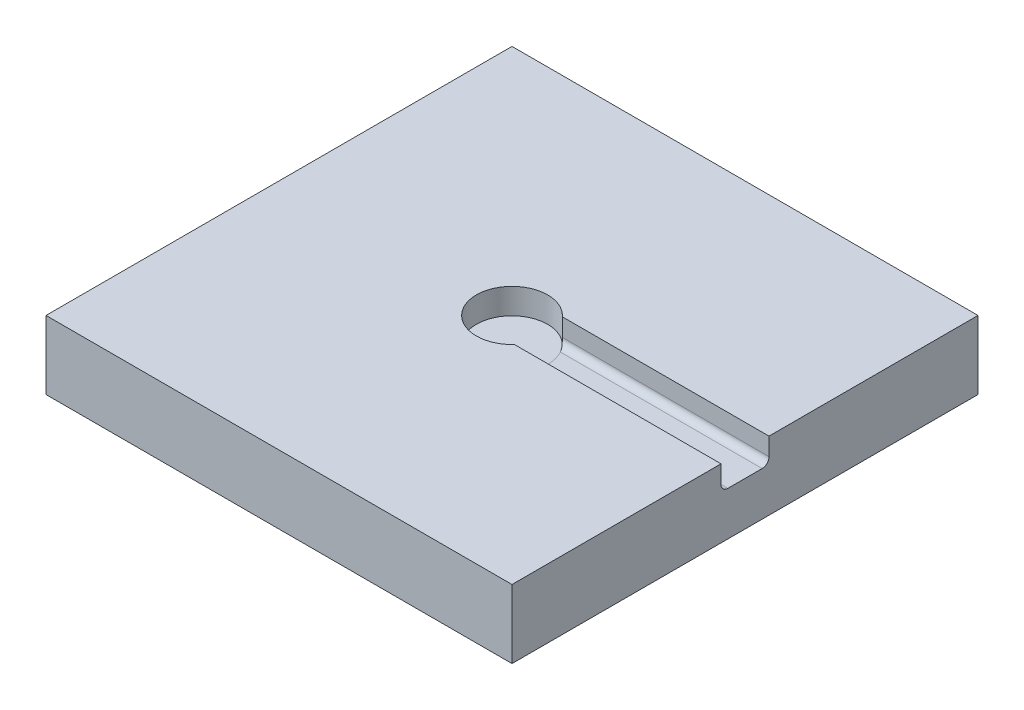
from build123d import *

# Parameters (mm, degrees)
SKETCH1_W           = 340
SKETCH1_H           = 340
BOSS_EXTRUDE1_DEPTH = 50
SKETCH2_R           = 26
CUT_EXTRUDE1_DEPTH  = 18.6
SKETCH3_W           = 35
SKETCH3_H           = 18
CUT_EXTRUDE2_DEPTH  = 170
FILLET1_R           = 5


with BuildPart() as part:
    # Sketch1 → Boss-Extrude1 (new body)
    with BuildSketch(Plane(origin=(0, 0, 0), x_dir=(1, 0, 0), z_dir=(0, 1, 0))):
        Rectangle(SKETCH1_W, SKETCH1_H)
    extrude(amount=BOSS_EXTRUDE1_DEPTH)

    # Sketch2 → Cut-Extrude1 (cut)
    with BuildSketch(Plane(origin=(0, 50, 0), x_dir=(1, 0, 0), z_dir=(0, 1, 0))):
        Circle(SKETCH2_R)
    extrude(amount=-CUT_EXTRUDE1_DEPTH, mode=Mode.SUBTRACT)

    # Sketch3 → Cut-Extrude2 (cut)
    with BuildSketch(Plane(origin=(170, 0, 0), x_dir=(0, 0, -1), z_dir=(1, 0, 0))):
        with Locations((0, 41)):
            Rectangle(SKETCH3_W, SKETCH3_H)
    extrude(amount=-CUT_EXTRUDE2_DEPTH, mode=Mode.SUBTRACT)

    # Fillet1
    fillet1_edges = [part.edges().sort_by_distance(p)[0] for p in [
        (94.614442262, 32, 17.5),
        (94.614442262, 32, -17.5),
    ]]
    fillet(fillet1_edges, radius=FILLET1_R)


solid = part.part
